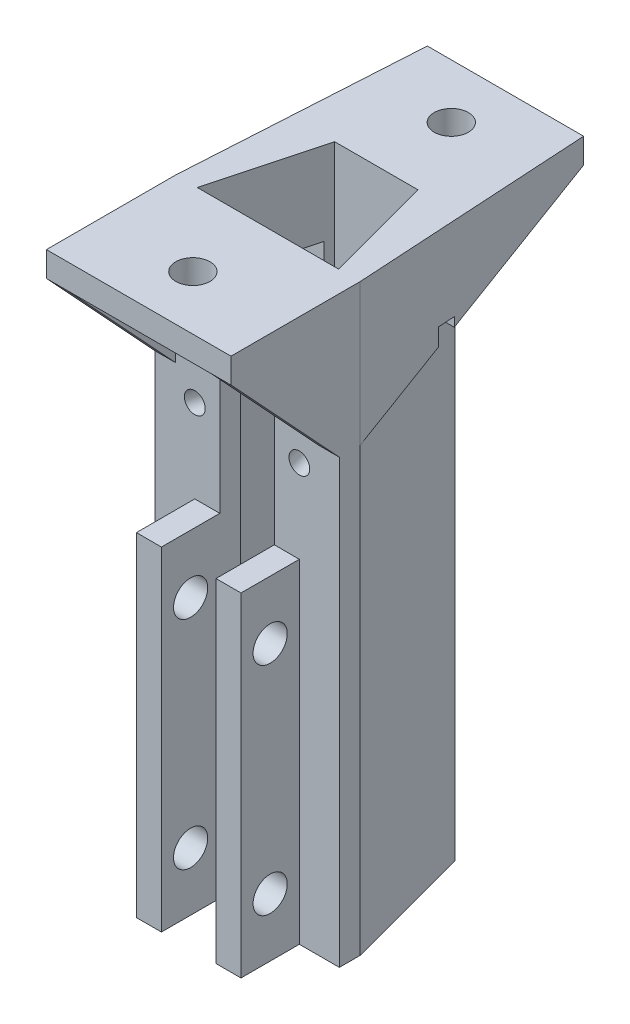
from build123d import *

# Parameters (mm, degrees)
BOSS_EXTRUDE1_DEPTH      = 40
SKETCH3_R                = 2.05
CUT_EXTRUDE2_DEPTH       = 40
BOSS_EXTRUDE2_DEPTH      = 30
SKETCH16_R               = 1.25
CUT_EXTRUDE9_DEPTH       = 3.5
SKETCH17_R               = 1.25
CUT_EXTRUDE10_DEPTH      = 3.5
SKETCH18_W               = 22.143059906
SKETCH18_H               = 3
BOSS_EXTRUDE4_DEPTH      = 15.5
BOSS_EXTRUDE5_DEPTH      = 13
BOSS_EXTRUDE5_DEPTH_BACK = 2
SKETCH19_W               = 13.83663494
SKETCH19_H               = 3
BOSS_EXTRUDE6_DEPTH      = 2.5
BOSS_EXTRUDE8_DEPTH      = 2.5
BOSS_EXTRUDE9_DEPTH      = 4.2
BOSS_EXTRUDE10_DEPTH     = 4.2
SKETCH25_R               = 2.05
CUT_EXTRUDE12_DEPTH      = 3.5
CUT_EXTRUDE13_DEPTH      = 71.528016285
CUT_EXTRUDE14_DEPTH      = 71.528016285
SKETCH28_W               = 2
SKETCH28_H               = 4.5
CUT_EXTRUDE15_DEPTH      = 79.280177966


with BuildPart() as part:
    # Sketch2 → Boss-Extrude1 (new body)
    with BuildSketch(Plane(origin=(0, 0, 0), x_dir=(1, 0, 0), z_dir=(0, 1, 0))):
        Polygon((5.768335638, 3.843580014), (-8.068299302, 3.843580014), (-12.221511785, -11.656419986), (-12.221511785, -14.156419986), (-7.421511785, -14.156419986), (-7.421511785, -21.156419986), (-4.421511785, -21.156419986), (-4.421511785, -11.656419986), (-9.633321334, -11.656419986), (-6.149981832, 1.343580014), (3.850018168, 1.343580014), (7.33335767, -11.656419986), (2.121548121, -11.656419986), (2.121548121, -21.156419986), (5.121548121, -21.156419986), (5.121548121, -14.156419986), (9.921548121, -14.156419986), (9.921548121, -11.656419986), align=None)
    extrude(amount=BOSS_EXTRUDE1_DEPTH)

    # Sketch3 → Cut-Extrude2 (cut)
    with BuildSketch(Plane.ZY.offset(7.421511785)):
        with Locations((17.656419986, 33)):
            Circle(SKETCH3_R)
        with Locations((17.656419986, 7)):
            Circle(SKETCH3_R)
    extrude(amount=-CUT_EXTRUDE2_DEPTH, mode=Mode.SUBTRACT)

    # Sketch4 → Boss-Extrude2 (add)
    with BuildSketch(Plane(origin=(0, 40, 0), x_dir=(1, 0, 0), z_dir=(0, 1, 0))):
        Polygon((-4.421511785, -11.656419986), (-9.633321334, -11.656419986), (-6.149981832, 1.343580014), (3.850018168, 1.343580014), (7.33335767, -11.656419986), (2.121548121, -11.656419986), (2.121548121, -14.156419986), (5.121548121, -14.156419986), (9.921548121, -14.156419986), (9.921548121, -11.656419986), (5.768335638, 3.843580014), (-8.068299302, 3.843580014), (-12.221511785, -11.656419986), (-12.221511785, -14.156419986), (-7.421511785, -14.156419986), (-4.421511785, -14.156419986), align=None)
    extrude(amount=BOSS_EXTRUDE2_DEPTH)

    # Sketch16 → Cut-Extrude9 (cut, along a direction that is not the sketch's normal)
    with BuildSketch(Plane.XY.offset(14.156419986)):
        with Locations((-7.421511785, 50)):
            Circle(SKETCH16_R)
    extrude(amount=-CUT_EXTRUDE9_DEPTH, dir=(-0.2588190451025246, 0, 0.9659258262890672), mode=Mode.SUBTRACT)

    # Sketch17 → Cut-Extrude10 (cut, along a direction that is not the sketch's normal)
    with BuildSketch(Plane.XY.offset(14.156419986)):
        with Locations((5.121548121, 50)):
            Circle(SKETCH17_R)
    extrude(amount=-CUT_EXTRUDE10_DEPTH, dir=(0.25881904510251796, 0, 0.9659258262890691), mode=Mode.SUBTRACT)

    # Sketch18 → Boss-Extrude4 (add)
    with BuildSketch(Plane(origin=(0, 0, 11.656419986), x_dir=(-1, 0, 0), z_dir=(0, 0, -1))):
        with Locations((1.149981832, 68.5)):
            Rectangle(SKETCH18_W, SKETCH18_H)
    extrude(amount=-BOSS_EXTRUDE4_DEPTH)

    # Sketch19 → Boss-Extrude5 (add, two sides: drawn at the far end of the back side and taken through both)
    with BuildSketch(Plane(origin=(0, 0, -3.843580014), x_dir=(-1, 0, 0), z_dir=(0, 0, -1)).offset(-BOSS_EXTRUDE5_DEPTH_BACK)):
        with Locations((1.149981832, 68.5)):
            Rectangle(SKETCH19_W, SKETCH19_H)
    extrude(amount=BOSS_EXTRUDE5_DEPTH + BOSS_EXTRUDE5_DEPTH_BACK)

    # Sketch21 → Boss-Extrude6 (add)
    with BuildSketch(Plane.ZY.offset(12.221511785)):
        Polygon((27.156419986, 67), (14.156419986, 53), (14.156419986, 67), align=None)
    extrude(amount=-BOSS_EXTRUDE6_DEPTH)

    # Sketch22 → Boss-Extrude8 (add)
    with BuildSketch(Plane(origin=(9.921548121, 0, 0), x_dir=(0, 0, -1), z_dir=(1, 0, 0))):
        Polygon((-27.156419986, 67), (-14.156419986, 67), (-14.156419986, 53), align=None)
    extrude(amount=-BOSS_EXTRUDE8_DEPTH)

    # Sketch23 → Boss-Extrude9 (add)
    with BuildSketch(Plane(origin=(9.921548121, 0, 0), x_dir=(0, 0, -1), z_dir=(1, 0, 0))):
        Polygon((-11.656419986, 70), (-11.656419986, 53), (16.843580014, 67), (16.843580014, 70), align=None)
    extrude(amount=-BOSS_EXTRUDE9_DEPTH)

    # Sketch24 → Boss-Extrude10 (add)
    with BuildSketch(Plane.ZY.offset(12.221511785)):
        Polygon((11.656419986, 70), (-16.843580014, 70), (-16.843580014, 67), (11.656419986, 53), align=None)
    extrude(amount=-BOSS_EXTRUDE10_DEPTH)

    # Sketch25 → Cut-Extrude12 (cut)
    with BuildSketch(Plane(origin=(0, 70, 0), x_dir=(1, 0, 0), z_dir=(0, 1, 0))):
        with Locations((-1.149981694, 10.343580014)):
            Circle(SKETCH25_R)
        with Locations((-1.149981723, -20.656419986)):
            Circle(SKETCH25_R)
    extrude(amount=-CUT_EXTRUDE12_DEPTH, mode=Mode.SUBTRACT)

    # Sketch26 → Cut-Extrude13 (cut, through all, along a direction that is not the sketch's normal)
    with BuildSketch(Plane(origin=(0, 47.309855268, 23.239928904), x_dir=(-1, 0, 0), z_dir=(-4.742047126241555e-14, -0.8975543264374147, -0.4409038796534669))):
        Polygon((-5.721548121, 12.905635433), (-7.33335767, 12.905635433), (-5.721548121, 19.607575306), align=None)
        Polygon((8.021511785, 12.905635433), (8.021511785, 19.607575306), (9.633321334, 12.905635433), align=None)
    extrude(amount=-CUT_EXTRUDE13_DEPTH, dir=(0, -1, 0), mode=Mode.SUBTRACT)

    # Sketch27 → Cut-Extrude14 (cut, through all, along a direction that is not the sketch's normal)
    with BuildSketch(Plane(origin=(0, 47.309855268, 23.239928904), x_dir=(-1, 0, 0), z_dir=(0, -0.8975543264374147, -0.440903879653467))):
        Polygon((12.221511785, 12.905635433), (10.521511785, 44.658588051), (12.221511785, 44.658588051), align=None)
        Polygon((-9.921548121, 12.905635433), (-9.921548121, 44.658588051), (-8.221548121, 44.658588051), align=None)
    extrude(amount=-CUT_EXTRUDE14_DEPTH, dir=(0, -1, 0), mode=Mode.SUBTRACT)

    # Sketch28 → Cut-Extrude15 (cut, through all)
    with BuildSketch(Plane.ZY.offset(12.221511785)):
        with Locations((0.656419986, 57.75)):
            Rectangle(SKETCH28_W, SKETCH28_H)
    extrude(amount=-CUT_EXTRUDE15_DEPTH, mode=Mode.SUBTRACT)


solid = part.part
